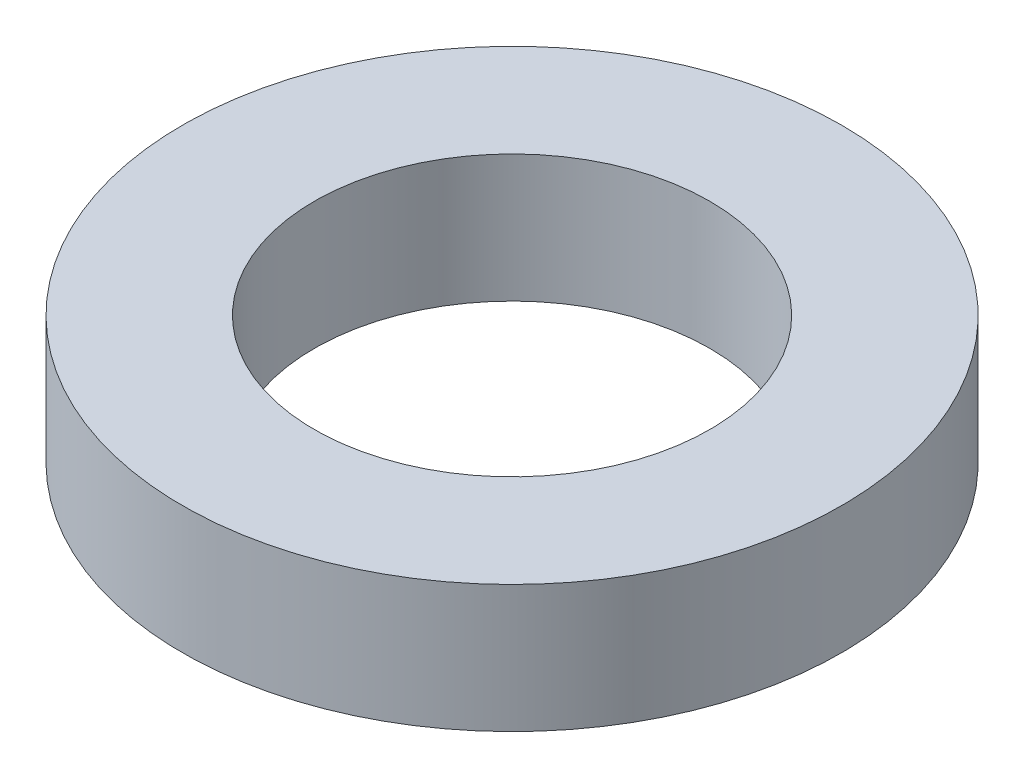
from build123d import *

# Parameters (mm, degrees)
SKETCH1_R           = 75
BOSS_EXTRUDE1_DEPTH = 29
SKETCH2_R           = 45
CUT_EXTRUDE1_DEPTH  = 110.959083299


with BuildPart() as part:
    # Sketch1 → Boss-Extrude1 (new body)
    with BuildSketch(Plane(origin=(0, 0, 0), x_dir=(1, 0, 0), z_dir=(0, 1, 0))):
        Circle(SKETCH1_R)
    extrude(amount=BOSS_EXTRUDE1_DEPTH)

    # Sketch2 → Cut-Extrude1 (cut, through all)
    with BuildSketch(Plane(origin=(0, 0, 0), x_dir=(1, 0, 0), z_dir=(0, 1, 0))):
        Circle(SKETCH2_R)
    extrude(amount=CUT_EXTRUDE1_DEPTH, mode=Mode.SUBTRACT)


solid = part.part
